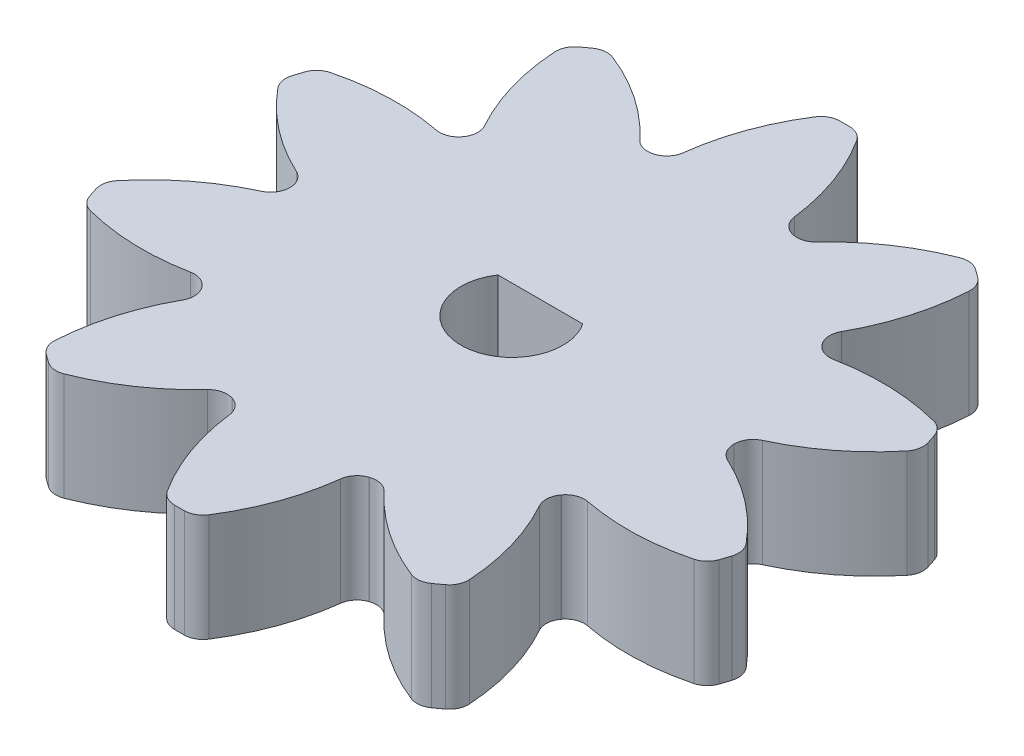
from build123d import *

# Parameters (mm, degrees)
SKETCH1_R                = 5.875
BASE_FLANGE2_DEPTH       = 2.85
TAB1_START               = -2.85
TAB1_DEPTH               = 2.85
FILLET1_R                = 0.5
CIRPATTERN1_COUNT        = 10
FILLET1_OF_CIRPATTERN1_R = 0.5
CUT_EXTRUDE1_DEPTH       = 13.516657182


# Read off the part's stored shape, not the designer's step: Tab1
# Sheet-metal steps are written as plain solids
with BuildPart() as part:
    # Sketch1 → Base-Flange2 (new body)
    with BuildSketch(Plane(origin=(0, 0, 0), x_dir=(1, 0, 0), z_dir=(0, 1, 0))):
        with Locations(Location((0, 0, 0), (0, 0, 270))):
            Circle(SKETCH1_R)
    extrude(amount=-BASE_FLANGE2_DEPTH)

    # Tab1 outline → Tab1 (add)
    with BuildSketch(Plane(origin=(0, 0, 0), x_dir=(1, 0, 0), z_dir=(0, 1, 0)).offset(TAB1_START)):
        with BuildLine():
            ThreePointArc((0.4, 8.79090439), (0, 8.8), (-0.4, 8.79090439))
            ThreePointArc((-0.4, 8.79090439), (-1.1629301, 7.310892011), (-1.5, 5.680283884))
            ThreePointArc((-1.5, 5.680283884), (0, 5.875), (1.5, 5.680283884))
            ThreePointArc((1.5, 5.680283884), (1.1629301, 7.310892011), (0.4, 8.79090439))
        make_face()
    tab1 = extrude(amount=TAB1_DEPTH)

    # Fillet1
    fillet1_edges = [part.edges().sort_by_distance(p)[0] for p in [
        (-1.5, -1.425, -5.680283884),
        (-0.4, -1.425, -8.79090439),
        (0.4, -1.425, -8.79090439),
        (1.5, -1.425, -5.680283884),
    ]]
    fillet(fillet1_edges, radius=FILLET1_R)

    # CirPattern1: Tab1 ×10 about axis
    cirpattern1_axis = Axis((0, 0, 0), (0, 1, 0))
    for i in range(1, CIRPATTERN1_COUNT):
        add(tab1.rotate(cirpattern1_axis, i * 360 / CIRPATTERN1_COUNT))

    # Fillet1 of CirPattern1
    fillet1_of_cirpattern1_edges = [part.edges().sort_by_distance(p)[0] for p in [
        (-4.552312587, -1.425, -3.713768317),
        (-5.490770753, -1.425, -6.876876947),
        (-4.843557157, -1.425, -7.347105148),
        (-2.125261604, -1.425, -5.477124073),
        (-5.865796494, -1.425, -0.328719479),
        (-8.484253702, -1.425, -2.336116246),
        (-8.237040106, -1.425, -3.096961459),
        (-4.938745511, -1.425, -3.181889027),
        (-4.938745511, -1.425, 3.181889027),
        (-8.237040106, -1.425, 3.096961459),
        (-8.484253702, -1.425, 2.336116246),
        (-5.865796494, -1.425, 0.328719479),
        (-2.125261604, -1.425, 5.477124073),
        (-4.843557157, -1.425, 7.347105148),
        (-5.490770753, -1.425, 6.876876947),
        (-4.552312587, -1.425, 3.713768317),
        (1.5, -1.425, 5.680283884),
        (0.4, -1.425, 8.79090439),
        (-0.4, -1.425, 8.79090439),
        (-1.5, -1.425, 5.680283884),
        (4.552312587, -1.425, 3.713768317),
        (5.490770753, -1.425, 6.876876947),
        (4.843557157, -1.425, 7.347105148),
        (2.125261604, -1.425, 5.477124073),
        (5.865796494, -1.425, 0.328719479),
        (8.484253702, -1.425, 2.336116246),
        (8.237040106, -1.425, 3.096961459),
        (4.938745511, -1.425, 3.181889027),
        (4.938745511, -1.425, -3.181889027),
        (8.237040106, -1.425, -3.096961459),
        (8.484253702, -1.425, -2.336116246),
        (5.865796494, -1.425, -0.328719479),
        (2.125261604, -1.425, -5.477124073),
        (4.843557157, -1.425, -7.347105148),
        (5.490770753, -1.425, -6.876876947),
        (4.552312587, -1.425, -3.713768317),
    ]]
    fillet(fillet1_of_cirpattern1_edges, radius=FILLET1_OF_CIRPATTERN1_R)

    # Sketch11 → Cut-Extrude1 (cut, through all)
    with BuildSketch(Plane(origin=(0, 0, 0), x_dir=(1, 0, 0), z_dir=(0, 1, 0))):
        with BuildLine():
            Line((-1.122497216, 0.75), (1.122497216, 0.75))
            ThreePointArc((1.122497216, 0.75), (0, -1.35), (-1.122497216, 0.75))
        make_face()
    extrude(amount=-CUT_EXTRUDE1_DEPTH, mode=Mode.SUBTRACT)


solid = part.part
